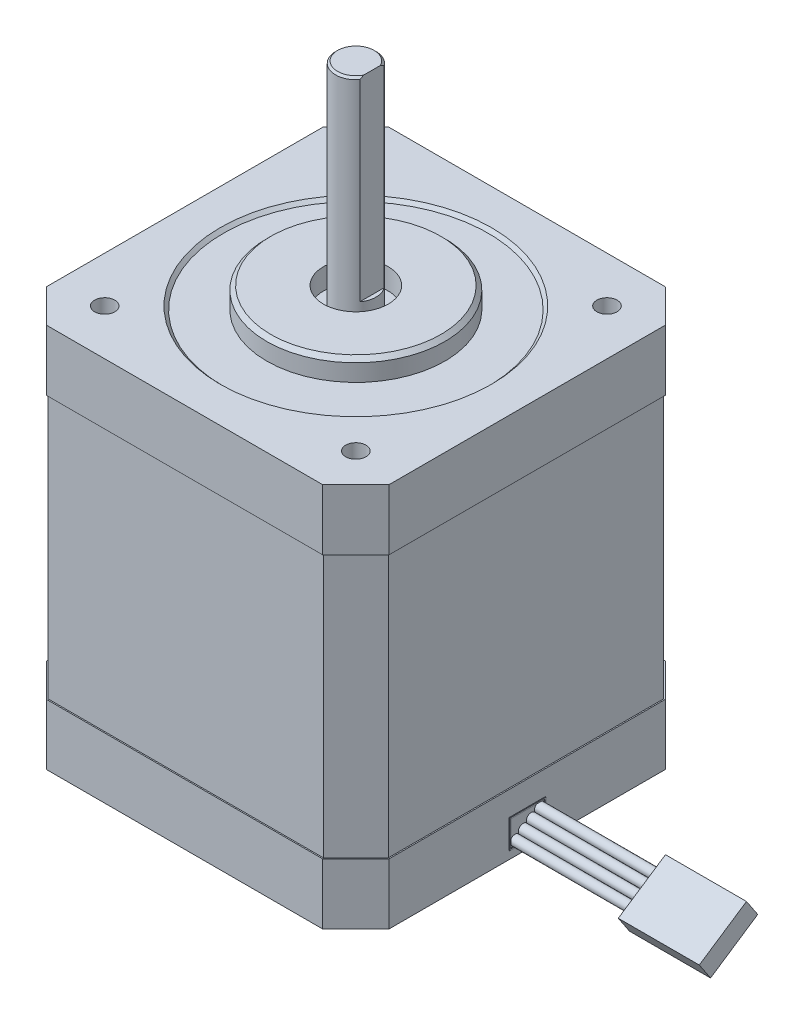
from build123d import *

# Parameters (mm, degrees)
CROQUIS1_W                          = 42
CROQUIS1_H                          = 42
SALIENTE_EXTRUIR1_DEPTH             = 47.5
CHAFL_N1_SIZE                       = 4
CROQUIS3_R                          = 16.25
CORTAR_EXTRUIR1_DEPTH               = 0.4
SALIENTE_EXTRUIR2_REACH             = 59.897
CROQUIS4_R                          = 11
CROQUIS4_R_2                        = 4
CHAFL_N2_SIZE                       = 0.5
CROQUIS5_R                          = 2.5
SALIENTE_EXTRUIR3_DEPTH             = 24
SALIENTE_EXTRUIR3_DIRECTION_2_REACH = 59.897
CORTAR_EXTRUIR2_DEPTH               = 24
CHAFL_N3_SIZE                       = 0.25
SALIENTE_EXTRUIR9_DEPTH             = 7.5
SALIENTE_EXTRUIR10_DEPTH            = 7.5
CROQUIS7_R                          = 1.25
CORTAR_EXTRUIR3_DEPTH               = 4.5
CROQUIS10_W                         = 4.5
CROQUIS10_H                         = 3.5
CROQUIS10_W_2                       = 4.2
CROQUIS10_H_2                       = 3.2
SALIENTE_EXTRUIR7_DEPTH             = 0.1
CROQUIS11_R                         = 0.600632734
SALIENTE_EXTRUIR8_DEPTH             = 15
SALIENTE_EXTRUIR8_2_DEPTH           = 15
SALIENTE_EXTRUIR8_3_DEPTH           = 15
SALIENTE_EXTRUIR8_4_DEPTH           = 15
SALIENTE_EXTRUIR11_DEPTH            = 10
CROQUIS15_R                         = 2.5
SALIENTE_EXTRUIR12_DEPTH            = 13


with BuildPart() as part:
    # Croquis1 → Saliente-Extruir1 (new body)
    with BuildSketch(Plane(origin=(0, 0, 0), x_dir=(1, 0, 0), z_dir=(0, 1, 0))):
        Rectangle(CROQUIS1_W, CROQUIS1_H)
    extrude(amount=SALIENTE_EXTRUIR1_DEPTH)

    # Chaflán1
    chafl_n1_edges = [part.edges().sort_by_distance(p)[0] for p in [
        (-21, 23.75, -21),
        (21, 23.75, -21),
        (21, 23.75, 21),
        (-21, 23.75, 21),
    ]]
    chamfer(chafl_n1_edges, length=CHAFL_N1_SIZE)

    # Croquis3 → Cortar-Extruir1 (cut)
    with BuildSketch(Plane(origin=(0, 47.5, 0), x_dir=(1, 0, 0), z_dir=(0, 1, 0))):
        with Locations(Location((0, 0, 0), (0, 0, 270))):
            Circle(CROQUIS3_R)
    extrude(amount=-CORTAR_EXTRUIR1_DEPTH, mode=Mode.SUBTRACT)

    # Croquis4 → Saliente-Extruir2 (add, up to next)
    with BuildSketch(Plane(origin=(0, 49.7, 0), x_dir=(1, 0, 0), z_dir=(0, 1, 0)), mode=Mode.PRIVATE) as saliente_extruir2_sk1:
        with Locations(Location((0, 0, 0), (0, 0, 270))):
            Circle(CROQUIS4_R)
        with Locations(Location((0, 0, 0), (0, 0, 270))):
            Circle(CROQUIS4_R_2, mode=Mode.SUBTRACT)
    saliente_extruir2_tool1 = extrude(saliente_extruir2_sk1.sketch, amount=-SALIENTE_EXTRUIR2_REACH, mode=Mode.PRIVATE) - part.part
    add(saliente_extruir2_tool1.solids().sort_by_distance((0, 49.7, -10.688873))[0])

    # Chaflán2
    # the kernel refuses this chamfer: 0.5 mm, written as the material it takes off along each edge
    with BuildSketch(Plane(origin=(0, 47.5, 0), x_dir=(0, 0, 1), z_dir=(-1, 0, 0))) as chafl_n2_piece_1_section:
        Polygon((16.25 + CHAFL_N2_SIZE, 0), (16.25, -CHAFL_N2_SIZE), (16.25, 0), align=None)
    chafl_n2_piece_1 = revolve(axis=Axis((0, 47.5, 0), (0, 1, 0)), mode=Mode.PRIVATE)
    chafl_n2_piece_1 = split(chafl_n2_piece_1, bisect_by=Plane(origin=(0, 47.1, -16.540253215), z_dir=(0, 1, 0)), keep=Keep.TOP, mode=Mode.PRIVATE)
    add(chafl_n2_piece_1, mode=Mode.SUBTRACT)
    with BuildSketch(Plane(origin=(0, 49.7, 0), x_dir=(0, 0, 1), z_dir=(-1, 0, 0))) as chafl_n2_piece_2:
        Polygon((11, -CHAFL_N2_SIZE), (11 - CHAFL_N2_SIZE, 0), (11, 0), align=None)
    revolve(axis=Axis((0, 49.7, 0), (0, 1, 0)), mode=Mode.SUBTRACT)


with BuildPart() as body_2:
    # Croquis5 → Saliente-Extruir3 (new body)
    with BuildSketch(Plane(origin=(0, 49.7, 0), x_dir=(1, 0, 0), z_dir=(0, 1, 0))):
        with Locations(Location((0, 0, 0), (0, 0, 270))):
            Circle(CROQUIS5_R)
    extrude(amount=SALIENTE_EXTRUIR3_DEPTH)


    # Croquis5 → Saliente-Extruir3 direction 2 (add, up to next)
    with BuildSketch(Plane(origin=(0, 49.7, 0), x_dir=(1, 0, 0), z_dir=(0, 1, 0)), mode=Mode.PRIVATE) as saliente_extruir3_direction_2_sk1:
        with Locations(Location((0, 0, 0), (0, 0, 270))):
            Circle(CROQUIS5_R)
    saliente_extruir3_direction_2_tool1 = extrude(saliente_extruir3_direction_2_sk1.sketch, amount=-SALIENTE_EXTRUIR3_DIRECTION_2_REACH, mode=Mode.PRIVATE) - part.part
    add(saliente_extruir3_direction_2_tool1.solids().sort_by_distance((0, 49.7, 0))[0])

    # Croquis6 → Cortar-Extruir2 (cut)
    with BuildSketch(Plane(origin=(0, 73.7, 0), x_dir=(1, 0, 0), z_dir=(0, 1, 0))):
        with BuildLine():
            Line((2, 1.5), (2, -1.5))
            ThreePointArc((2, -1.5), (2.5, 0), (2, 1.5))
        make_face()
    extrude(amount=-CORTAR_EXTRUIR2_DEPTH, mode=Mode.SUBTRACT)

    # Chaflán3
    chafl_n3_edges = [body_2.edges().sort_by_distance(p)[0] for p in [
        (-2.236067977, 73.7, -1.118033989),
    ]]
    chamfer(chafl_n3_edges, length=CHAFL_N3_SIZE)


    add(part.part)  # Saliente-Extruir9 merges part
    # Croquis12 → Saliente-Extruir9 (add)
    with BuildSketch(Plane(origin=(0, 47.5, 0), x_dir=(1, 0, 0), z_dir=(0, 1, 0))):
        Polygon((-17.062132034, 21.15), (-21.15, 17.062132034), (-21.15, -17.062132034), (-17.062132034, -21.15), (17.062132034, -21.15), (21.15, -17.062132034), (21.15, 17.062132034), (17.062132034, 21.15), align=None)
        Polygon((-17, 21), (-21, 17), (-21, -17), (-17, -21), (17, -21), (21, -17), (21, 17), (17, 21), align=None, mode=Mode.SUBTRACT)
    extrude(amount=-SALIENTE_EXTRUIR9_DEPTH)

    # Croquis13 → Saliente-Extruir10 (add)
    with BuildSketch(Plane.XZ):
        Polygon((-17.062132034, -21.15), (-21.15, -17.062132034), (-21.15, 17.062132034), (-17.062132034, 21.15), (17.062132034, 21.15), (21.15, 17.062132034), (21.15, -17.062132034), (17.062132034, -21.15), align=None)
        Polygon((-17, -21), (-21, -17), (-21, 17), (-17, 21), (17, 21), (21, 17), (21, -17), (17, -21), align=None, mode=Mode.SUBTRACT)
    extrude(amount=-SALIENTE_EXTRUIR10_DEPTH)

    # Croquis7 → Cortar-Extruir3 (cut)
    with BuildSketch(Plane(origin=(0, 47.5, 0), x_dir=(1, 0, 0), z_dir=(0, 1, 0))):
        with Locations(Location((-15.5, 15.5, 0), (0, 0, 270))):
            Circle(CROQUIS7_R)
        with Locations(Location((15.5, 15.5, 0), (0, 0, 270))):
            Circle(CROQUIS7_R)
        with Locations(Location((15.5, -15.5, 0), (0, 0, 270))):
            Circle(CROQUIS7_R)
        with Locations(Location((-15.5, -15.5, 0), (0, 0, 270))):
            Circle(CROQUIS7_R)
    extrude(amount=-CORTAR_EXTRUIR3_DEPTH, mode=Mode.SUBTRACT)

    # Croquis10 → Saliente-Extruir7 (add)
    with BuildSketch(Plane(origin=(21.15, 0, 0), x_dir=(0, 0, -1), z_dir=(1, 0, 0))):
        with Locations((0, 2.75)):
            Rectangle(CROQUIS10_W, CROQUIS10_H)
        with Locations((0, 2.75)):
            Rectangle(CROQUIS10_W_2, CROQUIS10_H_2, mode=Mode.SUBTRACT)
    extrude(amount=SALIENTE_EXTRUIR7_DEPTH)

    # Croquis15 → Saliente-Extruir12 (add)
    with BuildSketch(Plane.XZ):
        with Locations(Location((0, 0, 0), (0, 0, 90))):
            Circle(CROQUIS15_R)
    extrude(amount=SALIENTE_EXTRUIR12_DEPTH)


with BuildPart() as body_2_2:
    # Croquis11 → Saliente-Extruir8 (new body)
    with BuildSketch(Plane(origin=(21, 0, 0), x_dir=(0, 0, -1), z_dir=(1, 0, 0))):
        with Locations((-1.499367266, 1.750632734)):
            Circle(CROQUIS11_R)
    extrude(amount=SALIENTE_EXTRUIR8_DEPTH)


with BuildPart() as body_3:
    # Croquis11 → Saliente-Extruir8 2 (new body)
    with BuildSketch(Plane(origin=(21, 0, 0), x_dir=(0, 0, -1), z_dir=(1, 0, 0))):
        with Locations((-0.499789089, 2.416877578)):
            Circle(CROQUIS11_R)
    extrude(amount=SALIENTE_EXTRUIR8_2_DEPTH)


with BuildPart() as body_4:
    # Croquis11 → Saliente-Extruir8 3 (new body)
    with BuildSketch(Plane(origin=(21, 0, 0), x_dir=(0, 0, -1), z_dir=(1, 0, 0))):
        with Locations((0.499789089, 3.083122422)):
            Circle(CROQUIS11_R)
    extrude(amount=SALIENTE_EXTRUIR8_3_DEPTH)


with BuildPart() as body_5:
    # Croquis11 → Saliente-Extruir8 4 (new body)
    with BuildSketch(Plane(origin=(21, 0, 0), x_dir=(0, 0, -1), z_dir=(1, 0, 0))):
        with Locations((1.499367266, 3.749367266)):
            Circle(CROQUIS11_R)
    extrude(amount=SALIENTE_EXTRUIR8_4_DEPTH)


with BuildPart() as body_6:
    # Croquis14 → Saliente-Extruir11 (new body)
    with BuildSketch(Plane(origin=(36, 0, 0), x_dir=(0, 0, -1), z_dir=(1, 0, 0))):
        Polygon((-2.219091147, -0.231297449), (3.605639046, 3.651036666), (2.219091147, 5.731297449), (-3.605639046, 1.848963334), align=None)
    extrude(amount=SALIENTE_EXTRUIR11_DEPTH)


solid = Compound([body_2.part, body_2_2.part, body_3.part, body_4.part, body_5.part, body_6.part])
